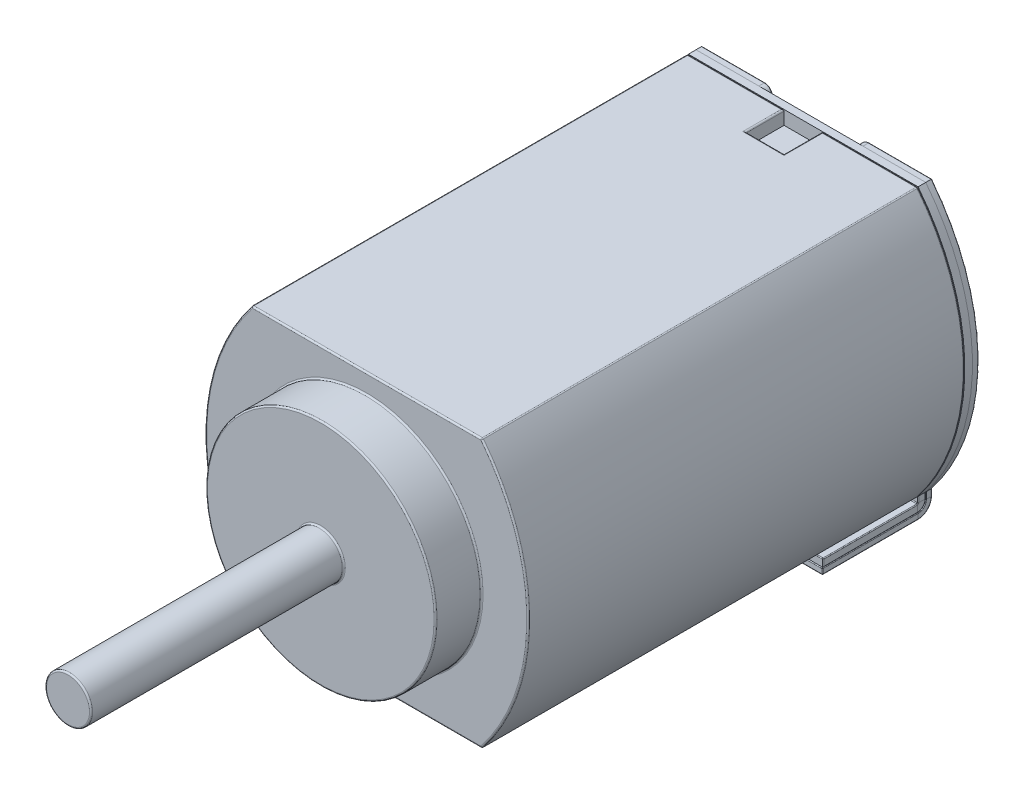
from build123d import *

# Parameters (mm, degrees)
EXTRUDE_1_DEPTH                  = 5.7
SKETCH_2_R                       = 1.5
EXTRUDE_2_DEPTH                  = 0.6
SKETCH_3_R                       = 0.3
EXTRUDE_3_DEPTH                  = 3.3
SKETCH_4_W                       = 0.5
SKETCH_4_H                       = 0.5
CUT_EXTRUDE_1_DEPTH              = 0.18
SM_BASE_FLANGE_1_DEPTH           = 0.1
SM_EDGE_FLANGE_1_DEPTH           = 0.512906165
SM_EDGE_FLANGE_2_DEPTH           = 0.512906165
SKETCH_18_R                      = 0.9
EXTRUDE_5_DEPTH                  = 0.18
SM_BASE_FLANGE_2_DEPTH           = 0.08
SM_EDGE_FLANGE_3_STRIP_W         = 0.52
SM_EDGE_FLANGE_3_STRIP_H         = 0.08
SM_EDGE_FLANGE_3_STRIP_CUT_DEPTH = 0.512906165
SM_EDGE_FLANGE_3_DEPTH           = 0.512906165
SM_EDGE_FLANGE_4_STRIP_W         = 0.52
SM_EDGE_FLANGE_4_STRIP_H         = 0.08
SM_EDGE_FLANGE_4_STRIP_CUT_DEPTH = 0.512906165
SM_EDGE_FLANGE_4_DEPTH           = 0.512906165
CUT_EXTRUDE_2_DEPTH              = 0.08
SKETCH_16_R                      = 0.9
EXTRUDE_4_DEPTH                  = 0.2
FILLET_1_R                       = 0.02
FILLET_2_R                       = 0.02
FILLET_3_R                       = 0.01
FILLET_4_R                       = 0.01
FILLET_5_R                       = 0.01
FILLET_6_R                       = 0.01
FILLET_7_R                       = 0.01


# Read off the part's stored shape, not the designer's step: 基体-法兰2
# Sheet-metal steps are written as plain solids
with BuildPart() as part:
    # Sketch 1 → 凸台-拉伸1 (new body)
    with BuildSketch(Plane.XY):
        with BuildLine():
            Line((-1.5, 1.75), (1.5, 1.75))
            ThreePointArc((1.5, 1.75), (2.11, 0), (1.5, -1.75))
            Line((1.5, -1.75), (-1.5, -1.75))
            ThreePointArc((-1.5, -1.75), (-2.11, 0), (-1.5, 1.75))
        make_face()
    extrude(amount=-EXTRUDE_1_DEPTH)

    # Sketch 2 → 凸台-拉伸2 (add)
    with BuildSketch(Plane.XY):
        Circle(SKETCH_2_R)
    extrude(amount=EXTRUDE_2_DEPTH)

    # Sketch 3 → 凸台-拉伸3 (add)
    with BuildSketch(Plane.XY.offset(0.6)):
        Circle(SKETCH_3_R)
    extrude(amount=EXTRUDE_3_DEPTH)

    # Sketch 4 → 切除-拉伸1 (cut)
    with BuildSketch(Plane(origin=(0, 1.75, 0), x_dir=(1, 0, 0), z_dir=(0, 1, 0))):
        with Locations((0, 5.45)):
            Rectangle(SKETCH_4_W, SKETCH_4_H)
    extrude(amount=-CUT_EXTRUDE_1_DEPTH, mode=Mode.SUBTRACT)

    # 圆角1
    fillet_1_edges = [part.edges().sort_by_distance(p)[0] for p in [
        (2.11, 0, -5.7),
        (-1.5, 0, 0),
        (-1.5, 0, 0.6),
        (0.875, 1.75, -5.7),
        (-0.3, 0, 0.6),
        (-0.3, 0, 3.9),
        (-0.875, 1.75, -5.7),
        (0.25, 1.75, -5.45),
        (-0.25, 1.75, -5.45),
        (0, 1.75, -5.2),
        (-2.11, 0, -5.7),
        (0, 1.75, 0),
        (2.11, 0, 0),
        (0, -1.75, 0),
        (-2.11, 0, 0),
        (-1.5, 1.75, -2.85),
        (1.5, 1.75, -2.85),
        (1.5, -1.75, -2.85),
        (-1.5, -1.75, -2.85),
        (0, -1.75, -5.7),
    ]]
    fillet(fillet_1_edges, radius=FILLET_1_R)


with BuildPart() as body_2:
    # Sketch 5 → 基体-法兰1 (new body)
    with BuildSketch(Plane(origin=(0, 0, -5.7), x_dir=(-1, 0, 0), z_dir=(0, 0, -1))):
        with BuildLine():
            Line((0.987093835, -1.75), (-0.987093835, -1.75))
            Line((-0.987093835, -1.75), (-0.987093835, -1.82602858))
            Line((-0.987093835, -1.82602858), (-1.5, -1.82602858))
            Line((-1.5, -1.82602858), (-1.5, -1.75))
            ThreePointArc((-1.5, -1.75), (-2.11, 0), (-1.5, 1.75))
            Line((-1.5, 1.75), (1.5, 1.75))
            ThreePointArc((1.5, 1.75), (2.11, 0), (1.5, -1.75))
            Line((1.5, -1.75), (1.5, -1.82602858))
            Line((1.5, -1.82602858), (0.987093835, -1.82602858))
            Line((0.987093835, -1.82602858), (0.987093835, -1.75))
        make_face()
    extrude(amount=SM_BASE_FLANGE_1_DEPTH)

    # 边线-法兰1 section (across the edge) → 边线-法兰1 (add)
    with BuildSketch(Plane(origin=(0.987093835, -1.83602858, -5.7), x_dir=(0, 1, 0), z_dir=(1, 0, 0))):
        with BuildLine():
            Line((-0.1, 0.01), (-0.1, 1.24))
            Line((-0.1, 1.24), (0, 1.24))
            Line((0, 1.24), (0, 0.01))
            ThreePointArc((0, 0.01), (0.002928932, 0.002928932), (0.01, 0))
            Line((0.01, 0), (0.01, -0.1))
            ThreePointArc((0.01, -0.1), (-0.067781746, -0.067781746), (-0.1, 0.01))
        make_face()
    extrude(amount=SM_EDGE_FLANGE_1_DEPTH)

    # 边线-法兰2 section (across the edge) → 边线-法兰2 (add)
    with BuildSketch(Plane(origin=(-1.5, -1.83602858, -5.7), x_dir=(0, 1, 0), z_dir=(1, 0, 0))):
        with BuildLine():
            Line((-0.1, 0.01), (-0.1, 1.24))
            Line((-0.1, 1.24), (0, 1.24))
            Line((0, 1.24), (0, 0.01))
            ThreePointArc((0, 0.01), (0.002928932, 0.002928932), (0.01, 0))
            Line((0.01, 0), (0.01, -0.1))
            ThreePointArc((0.01, -0.1), (-0.067781746, -0.067781746), (-0.1, 0.01))
        make_face()
    extrude(amount=SM_EDGE_FLANGE_2_DEPTH)

    # 草图18 → 凸台-拉伸5 (add)
    with BuildSketch(Plane(origin=(0, 0, -5.8), x_dir=(-1, 0, 0), z_dir=(0, 0, -1))):
        with Locations(Location((0, 0, 0), (0, 0, 180))):
            Circle(SKETCH_18_R)
    extrude(amount=EXTRUDE_5_DEPTH)


with BuildPart() as body_3:
    # 基体-法兰2 outline → 基体-法兰2 (new body)
    with BuildSketch(Plane(origin=(0, 0, -5.8), x_dir=(-1, 0, 0), z_dir=(0, 0, -1))):
        with BuildLine():
            Line((-0.987093835, -1.75), (0.987093835, -1.75))
            Line((0.987093835, -1.75), (0.987093835, -1.93602858))
            Line((0.987093835, -1.93602858), (1.5, -1.93602858))
            Line((1.5, -1.93602858), (1.5, -1.75))
            ThreePointArc((1.5, -1.75), (2.11, 0), (1.5, 1.75))
            Line((1.5, 1.75), (-1.5, 1.75))
            ThreePointArc((-1.5, 1.75), (-2.11, 0), (-1.5, -1.75))
            Line((-1.5, -1.75), (-1.5, -1.93602858))
            Line((-1.5, -1.93602858), (-0.987093835, -1.93602858))
            Line((-0.987093835, -1.93602858), (-0.987093835, -1.75))
        make_face()
    extrude(amount=SM_BASE_FLANGE_2_DEPTH)

    # 边线-法兰3 strip (across the edge) → 边线-法兰3 strip cut (cut)
    with BuildSketch(Plane(origin=(0.987093835, -1.93602858, -5.8), x_dir=(0, 1, 0), z_dir=(1, 0, 0))):
        with Locations((-0.16, -0.04)):
            Rectangle(SM_EDGE_FLANGE_3_STRIP_W, SM_EDGE_FLANGE_3_STRIP_H)
    extrude(amount=SM_EDGE_FLANGE_3_STRIP_CUT_DEPTH, mode=Mode.SUBTRACT)

    # 边线-法兰3 section (across the edge) → 边线-法兰3 (add)
    with BuildSketch(Plane(origin=(0.987093835, -1.93602858, -5.8), x_dir=(0, 1, 0), z_dir=(1, 0, 0))):
        with BuildLine():
            Line((-0.08, 0.1), (-0.08, 1.35))
            Line((-0.08, 1.35), (0, 1.35))
            Line((0, 1.35), (0, 0.1))
            ThreePointArc((0, 0.1), (0.029289322, 0.029289322), (0.1, 0))
            Line((0.1, 0), (0.1, -0.08))
            ThreePointArc((0.1, -0.08), (-0.027279221, -0.027279221), (-0.08, 0.1))
        make_face()
    extrude(amount=SM_EDGE_FLANGE_3_DEPTH)

    # 边线-法兰4 strip (across the edge) → 边线-法兰4 strip cut (cut)
    with BuildSketch(Plane(origin=(-1.5, -1.93602858, -5.8), x_dir=(0, 1, 0), z_dir=(1, 0, 0))):
        with Locations((-0.16, -0.04)):
            Rectangle(SM_EDGE_FLANGE_4_STRIP_W, SM_EDGE_FLANGE_4_STRIP_H)
    extrude(amount=SM_EDGE_FLANGE_4_STRIP_CUT_DEPTH, mode=Mode.SUBTRACT)

    # 边线-法兰4 section (across the edge) → 边线-法兰4 (add)
    with BuildSketch(Plane(origin=(-1.5, -1.93602858, -5.8), x_dir=(0, 1, 0), z_dir=(1, 0, 0))):
        with BuildLine():
            Line((-0.08, 0.1), (-0.08, 1.35))
            Line((-0.08, 1.35), (0, 1.35))
            Line((0, 1.35), (0, 0.1))
            ThreePointArc((0, 0.1), (0.029289322, 0.029289322), (0.1, 0))
            Line((0.1, 0), (0.1, -0.08))
            ThreePointArc((0.1, -0.08), (-0.027279221, -0.027279221), (-0.08, 0.1))
        make_face()
    extrude(amount=SM_EDGE_FLANGE_4_DEPTH)


with BuildPart() as cut_extrude_2_tool:
    # 草图28 → 切除-拉伸2 (new body)
    with BuildSketch(Plane(origin=(0, 0, -5.88), x_dir=(-1, 0, 0), z_dir=(0, 0, -1))):
        with BuildLine():
            Line((-0.987093835, -1.75), (-0.488826231, -0.866630784))
            ThreePointArc((-0.488826231, -0.866630784), (-0.478374399, -0.79550862), (-0.518333312, -0.735751709))
            ThreePointArc((-0.518333312, -0.735751709), (-0.899163636, -0.038791179), (-0.579772258, 0.688377897))
            Line((-0.579772258, 0.688377897), (-0.579772258, 1.65))
            ThreePointArc((-0.579772258, 1.65), (-0.60906158, 1.720710678), (-0.679772258, 1.75))
            Line((-0.679772258, 1.75), (0.679772258, 1.75))
            ThreePointArc((0.679772258, 1.75), (0.60906158, 1.720710678), (0.579772258, 1.65))
            Line((0.579772258, 1.65), (0.579772258, 0.688377897))
            ThreePointArc((0.579772258, 0.688377897), (0.899163636, -0.038791179), (0.518333312, -0.735751709))
            ThreePointArc((0.518333312, -0.735751709), (0.478374399, -0.79550862), (0.488826231, -0.866630784))
            Line((0.488826231, -0.866630784), (0.987093835, -1.75))
            Line((0.987093835, -1.75), (-0.987093835, -1.75))
        make_face()
    extrude(amount=-CUT_EXTRUDE_2_DEPTH)


with BuildPart() as body_2_1:
    add(body_2.part)

    # 切除-拉伸2: cut by cut_extrude_2_tool
    add(cut_extrude_2_tool.part, mode=Mode.SUBTRACT)


with BuildPart() as body_3_1:
    add(body_3.part)

    # 切除-拉伸2: cut by cut_extrude_2_tool
    add(cut_extrude_2_tool.part, mode=Mode.SUBTRACT)


with BuildPart() as cut_extrude_2_piece_1:
    # of the separate pieces the step leaves, piece 1, a body of its own (cut_extrude_2_pieces)
    add(body_2_1.part.solids().sort_by_distance((-1.5, 1.75, -5.7))[0])

    # 草图16 → 凸台-拉伸4 (add)
    with BuildSketch(Plane(origin=(0, 0, -5.8), x_dir=(-1, 0, 0), z_dir=(0, 0, -1))):
        Circle(SKETCH_16_R)
    extrude(amount=EXTRUDE_4_DEPTH)

    # 圆角2
    fillet_2_edges = [cut_extrude_2_piece_1.edges().sort_by_distance(p)[0] for p in [
        (0.9, 0, -6),
    ]]
    fillet(fillet_2_edges, radius=FILLET_2_R)

    # 圆角5
    fillet_5_edges = [cut_extrude_2_piece_1.edges().sort_by_distance(p)[0] for p in [
        (1.5, -1.78801429, -5.8),
        (1.5, -1.78801429, -5.7),
        (0.987093835, -1.78801429, -5.7),
        (-0.987093835, -1.78801429, -5.7),
        (-1.5, -1.78801429, -5.7),
        (1.5, -1.903810326, -5.767781746),
        (0.987093835, -1.833099648, -5.697071068),
        (1.5, -1.833099648, -5.697071068),
        (1.5, -1.93602858, -5.075),
        (0.987093835, -1.88602858, -4.46),
        (0.987093835, -1.83602858, -5.075),
        (1.243546918, -1.83602858, -4.46),
        (1.5, -1.83602858, -5.075),
        (1.5, -1.88602858, -4.46),
        (-1.5, -1.833099648, -5.697071068),
        (-0.987093835, -1.833099648, -5.697071068),
        (-1.5, -1.88602858, -4.46),
        (-1.5, -1.83602858, -5.075),
        (-1.243546918, -1.83602858, -4.46),
        (-0.987093835, -1.83602858, -5.075),
        (-0.987093835, -1.88602858, -4.46),
    ]]
    fillet(fillet_5_edges, radius=FILLET_5_R)


with BuildPart() as cut_extrude_2_piece_2:
    # of the separate pieces the step leaves, piece 2, a body of its own (cut_extrude_2_pieces)
    add(body_2_1.part.solids().sort_by_distance((0.9, 0, -5.88))[0])


with BuildPart() as cut_extrude_2_piece_1_of_body_3:
    # of the separate pieces the step leaves, piece 1, a body of its own (cut_extrude_2_pieces_of_body_3)
    add(body_3_1.part.solids().sort_by_distance((-1.5, -1.75, -5.8))[0])

    # 圆角4
    fillet_4_edges = [cut_extrude_2_piece_1_of_body_3.edges().sort_by_distance(p)[0] for p in [
        (-0.737960033, -1.308315392, -5.88),
        (-0.478374399, -0.79550862, -5.88),
        (-0.899163636, -0.038791179, -5.88),
        (-0.579772258, 1.169188948, -5.88),
        (-0.60906158, 1.720710678, -5.88),
        (-2.11, 0, -5.88),
        (-1.089886129, 1.75, -5.88),
        (-1.5, -1.79301429, -5.88),
        (-0.987093835, -1.79301429, -5.88),
        (-1.5, -1.9633078, -5.827279221),
        (-0.987093835, -1.9633078, -5.827279221),
        (-0.987093835, -2.01602858, -5.075),
        (-1.5, -2.01602858, -5.075),
    ]]
    fillet(fillet_4_edges, radius=FILLET_4_R)

    # 圆角7
    fillet_7_edges = [cut_extrude_2_piece_1_of_body_3.edges().sort_by_distance(p)[0] for p in [
        (-1.243546918, -1.93602858, -4.45),
        (-0.987093835, -1.93602858, -5.075),
        (-1.5, -1.97102858, -4.45),
        (-1.243546918, -2.01602858, -4.45),
        (-0.987093835, -1.97102858, -4.45),
        (-0.990022767, -2.013099648, -4.45),
        (-1.497071068, -2.013099648, -4.45),
        (-0.987093835, -1.79301429, -5.8),
        (-1.5, -1.79301429, -5.8),
        (-1.5, -1.906739258, -5.770710678),
        (-0.987093835, -1.906739258, -5.770710678),
        (-1.5, -1.93602858, -5.075),
    ]]
    fillet(fillet_7_edges, radius=FILLET_7_R)


with BuildPart() as cut_extrude_2_piece_2_of_body_3:
    # of the separate pieces the step leaves, piece 2, a body of its own (cut_extrude_2_pieces_of_body_3)
    add(body_3_1.part.solids().sort_by_distance((1.5, -1.75, -5.8))[0])

    # 圆角3
    fillet_3_edges = [cut_extrude_2_piece_2_of_body_3.edges().sort_by_distance(p)[0] for p in [
        (0.987093835, -1.79301429, -5.88),
        (1.089886129, 1.75, -5.88),
        (2.11, 0, -5.88),
        (1.5, -1.79301429, -5.88),
        (0.987093835, -1.9633078, -5.827279221),
        (1.5, -1.9633078, -5.827279221),
        (1.5, -2.01602858, -5.075),
        (0.987093835, -2.01602858, -5.075),
        (0.737960033, -1.308315392, -5.88),
        (0.478374399, -0.79550862, -5.88),
        (0.899163636, -0.038791179, -5.88),
        (0.579772258, 1.169188948, -5.88),
        (0.60906158, 1.720710678, -5.88),
    ]]
    fillet(fillet_3_edges, radius=FILLET_3_R)

    # 圆角6
    fillet_6_edges = [cut_extrude_2_piece_2_of_body_3.edges().sort_by_distance(p)[0] for p in [
        (1.5, -1.79301429, -5.8),
        (0.987093835, -1.79301429, -5.8),
        (1.5, -1.97102858, -4.45),
        (0.987093835, -1.906739258, -5.770710678),
        (1.243546918, -2.01602858, -4.45),
        (1.5, -1.906739258, -5.770710678),
        (0.987093835, -1.97102858, -4.45),
        (0.990022767, -2.013099648, -4.45),
        (1.497071068, -2.013099648, -4.45),
        (0.987093835, -1.93602858, -5.075),
        (1.243546918, -1.93602858, -4.45),
        (1.5, -1.93602858, -5.075),
    ]]
    fillet(fillet_6_edges, radius=FILLET_6_R)


solid = Compound([part.part, cut_extrude_2_piece_1.part, cut_extrude_2_piece_2.part, cut_extrude_2_piece_1_of_body_3.part, cut_extrude_2_piece_2_of_body_3.part])
